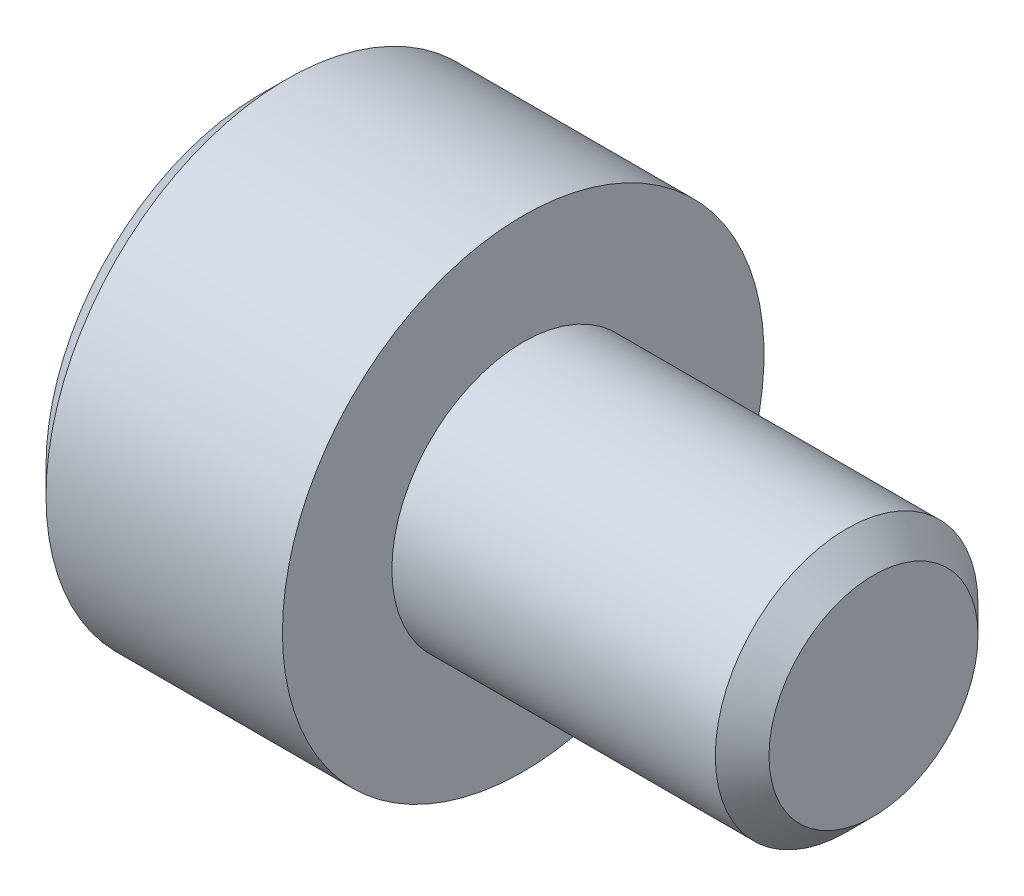
from build123d import *

# Parameters (mm, degrees)
CUT_EXTRUDE1_DEPTH = 1.5


with BuildPart() as part:
    # Sketch1 → Revolve1 (revolve)
    with BuildSketch(Plane.XY):
        Polygon((-3, 0), (4, 0), (4, -1.1935), (3.6935, -1.5), (0, -1.5), (0, -2.75), (-2.7, -2.75), (-3, -2.45), align=None)
    revolve(axis=Axis((-3.35, 0, 0), (1, 0, 0)))

    # Sketch2 → Cut-Extrude1 (cut)
    with BuildSketch(Plane.ZY.offset(3)):
        Polygon((0, 1.443375673), (-1.25, 0.721687836), (-1.25, -0.721687836), (0, -1.443375673), (1.25, -0.721687836), (1.25, 0.721687836), align=None)
    extrude(amount=-CUT_EXTRUDE1_DEPTH, mode=Mode.SUBTRACT)


solid = part.part
